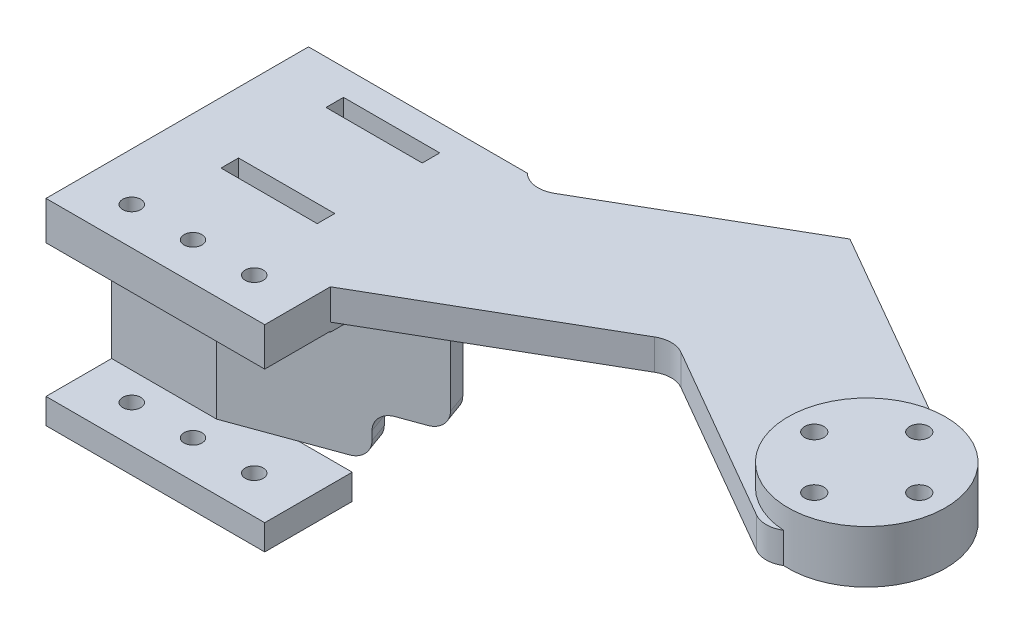
from build123d import *

# Parameters (mm, degrees)
SKETCH_1_W               = 25
SKETCH_1_H               = 10
EXTRUDE_1_DEPTH          = 22.5
SKETCH_2_W               = 25
SKETCH_2_H               = 15.2
CUT_EXTRUDE_1_DEPTH      = 7.5
CUT_EXTRUDE_2_DEPTH      = 36.089172119
CUT_EXTRUDE_2_DEPTH_BACK = 36.089172119
SKETCH_4_R               = 1.03
SKETCH_5_W               = 25
SKETCH_5_H               = 4.5
EXTRUDE_2_DEPTH          = 20
SKETCH_6_W               = 11
SKETCH_6_H               = 2
CUT_EXTRUDE_3_DEPTH      = 4.5
EXTRUDE_3_DEPTH          = 3.5
SKETCH_16_R              = 9
EXTRUDE_4_DEPTH          = 6
FILLET_1_R               = 3
CUT_EXTRUDE_4_REACH      = 94.322
SKETCH_17_R              = 1.1
SKETCH_19_W              = 13
SKETCH_19_H              = 15.1
CUT_EXTRUDE_5_DEPTH      = 10
EXTRUDE_5_REACH          = 95.01
CUT_EXTRUDE_6_REACH      = 96.037
SKETCH_22_W              = 7
SKETCH_22_H              = 5
FILLET_3_R               = 2


with BuildPart() as part:
    # 草图1 → 凸台-拉伸1 (new body)
    with BuildSketch(Plane(origin=(0, 0, 0), x_dir=(1, 0, 0), z_dir=(0, 1, 0))):
        with Locations((12.5, -5)):
            Rectangle(SKETCH_1_W, SKETCH_1_H)
    extrude(amount=EXTRUDE_1_DEPTH)

    # 草图2 → 切除-拉伸1 (cut)
    with BuildSketch(Plane.XY.offset(10)):
        with Locations((12.5, 10.5)):
            Rectangle(SKETCH_2_W, SKETCH_2_H)
    extrude(amount=-CUT_EXTRUDE_1_DEPTH, mode=Mode.SUBTRACT)

    # 草图4 → 切除-拉伸2 (cut, two sides: drawn at the far end of the back side and taken through both)
    with BuildSketch(Plane(origin=(0, 22.5, 0), x_dir=(1, 0, 0), z_dir=(0, 1, 0)).offset(-CUT_EXTRUDE_2_DEPTH_BACK)):
        with Locations(Location((12.5, -5.7, 0), (0, 0, 270))):
            Circle(SKETCH_4_R)
        with Locations(Location((19.5, -5.7, 0), (0, 0, 270))):
            Circle(SKETCH_4_R)
        with Locations(Location((5.5, -5.7, 0), (0, 0, 270))):
            Circle(SKETCH_4_R)
    extrude(amount=CUT_EXTRUDE_2_DEPTH + CUT_EXTRUDE_2_DEPTH_BACK, mode=Mode.SUBTRACT)

    # 草图5 → 凸台-拉伸2 (add)
    with BuildSketch(Plane(origin=(0, 0, 0), x_dir=(-1, 0, 0), z_dir=(0, 0, -1))):
        with Locations((-12.5, 20.25)):
            Rectangle(SKETCH_5_W, SKETCH_5_H)
    extrude(amount=EXTRUDE_2_DEPTH)

    # 草图6 → 切除-拉伸3 (cut)
    with BuildSketch(Plane(origin=(0, 22.5, 0), x_dir=(1, 0, 0), z_dir=(0, 1, 0))):
        with Locations((12.5, 16)):
            Rectangle(SKETCH_6_W, SKETCH_6_H)
        with Locations((12.5, 4)):
            Rectangle(SKETCH_6_W, SKETCH_6_H)
    extrude(amount=-CUT_EXTRUDE_3_DEPTH, mode=Mode.SUBTRACT)

    # 草图15 → 凸台-拉伸3 (add)
    with BuildSketch(Plane(origin=(0, 22.5, 0), x_dir=(1, 0, 0), z_dir=(0, 1, 0))):
        Polygon((25, -2.5), (50, 11.93375673), (75, -2.5), (75, 17.5), (49.967235844, 31.914840335), (25, 17.5), align=None)
    extrude(amount=-EXTRUDE_3_DEPTH)

    # 草图16 → 凸台-拉伸4 (add)
    with BuildSketch(Plane.XZ.offset(-19)):
        with Locations(Location((75.52146997, -8.282050808, 0), (0, 0, 270))):
            Circle(SKETCH_16_R)
    extrude(amount=-EXTRUDE_4_DEPTH)

    # 圆角1
    # the kernel refuses this fillet: 3 mm, written as the material it adds along each edge
    with BuildSketch(Plane(origin=(50, 22.5, -11.93375673), x_dir=(-0.8660254037844394, 0, 0.4999999999999987), z_dir=(0, -1, 0))) as fillet_1_piece_1:
        with BuildLine():
            CenterArc((FILLET_1_R * 0.57735026919, -FILLET_1_R), FILLET_1_R, 90, 60)
            Line((-FILLET_1_R * 0.288675134595, -FILLET_1_R * 0.5), (-FILLET_1_R * 0.305995642671, -FILLET_1_R * 0.49))
            Line((-FILLET_1_R * 0.305995642671, -FILLET_1_R * 0.49), (-FILLET_1_R * 0.0115470053838, FILLET_1_R * 0.02))
            Line((-FILLET_1_R * 0.0115470053838, FILLET_1_R * 0.02), (FILLET_1_R * 0.57735026919, FILLET_1_R * 0.02))
            Line((FILLET_1_R * 0.57735026919, FILLET_1_R * 0.02), (FILLET_1_R * 0.57735026919, 0))
        make_face()
    extrude(amount=3.5)
    with BuildSketch(Plane(origin=(25, 22.5, -17.5), x_dir=(0, 0, -1), z_dir=(0, -1, 0))) as fillet_1_piece_2:
        with BuildLine():
            CenterArc((4.663812226, 2.077959733), FILLET_1_R, 150, 73.840504848)
            Line((2.065736015, 3.577959733), (2.013774491, 3.607959733))
            Line((2.013774491, 3.607959733), (-0.051961524, 0.03))
            Line((-0.051961524, 0.03), (0, -0.06))
            ThreePointArc((0, -0.06), (1.25, -0.06), (2.456723755, -0.041559195))
            Line((2.456723755, -0.041559195), (2.5, 0))
        make_face()
    extrude(amount=3.5)
    # the kernel refuses this fillet: 3 mm, written as the material it takes off along each edge
    with BuildSketch(Plane(origin=(75, 31.321038653, 2.5), x_dir=(0, 0, -1), z_dir=(0, -1, 0))) as fillet_1_2_piece_1:
        with BuildLine():
            CenterArc((4.362283942, -1.555697425), FILLET_1_R, 148.763902171, 61.236097829)
            Line((1.764207731, -3.055697425), (1.712246206, -3.085697425))
            Line((1.712246206, -3.085697425), (-0.051961524, -0.03))
            Line((-0.051961524, -0.03), (0, 0.06))
            ThreePointArc((0, 0.06), (0.898585391, 0.06), (1.745868519, 0.031113948))
            Line((1.745868519, 0.031113948), (1.797170782, 0))
        make_face()
    extrude(amount=21.142077307, mode=Mode.SUBTRACT)

    # 草图17 → 切除-拉伸4 (cut, up to next)
    with BuildSketch(Plane.XZ.offset(-19), mode=Mode.PRIVATE) as cut_extrude_4_sk1:
        with Locations(Location((75.521469969, -14.282050811, 0), (0, 0, 270))):
            Circle(SKETCH_17_R)
    cut_extrude_4_tool1 = extrude(cut_extrude_4_sk1.sketch, amount=-CUT_EXTRUDE_4_REACH, mode=Mode.PRIVATE) & part.part
    # 草图17 → 切除-拉伸4 (cut, up to next)
    with BuildSketch(Plane.XZ.offset(-19), mode=Mode.PRIVATE) as cut_extrude_4_sk2:
        with Locations(Location((75.521469969, -2.282050808, 0), (0, 0, 270))):
            Circle(SKETCH_17_R)
    cut_extrude_4_tool2 = extrude(cut_extrude_4_sk2.sketch, amount=-CUT_EXTRUDE_4_REACH, mode=Mode.PRIVATE) & part.part
    # 草图17 → 切除-拉伸4 (cut, up to next)
    with BuildSketch(Plane.XZ.offset(-19), mode=Mode.PRIVATE) as cut_extrude_4_sk3:
        with Locations(Location((69.521469967, -8.282050809, 0), (0, 0, 270))):
            Circle(SKETCH_17_R)
    cut_extrude_4_tool3 = extrude(cut_extrude_4_sk3.sketch, amount=-CUT_EXTRUDE_4_REACH, mode=Mode.PRIVATE) & part.part
    # 草图17 → 切除-拉伸4 (cut, up to next)
    with BuildSketch(Plane.XZ.offset(-19), mode=Mode.PRIVATE) as cut_extrude_4_sk4:
        with Locations(Location((81.52146997, -8.282050809, 0), (0, 0, 270))):
            Circle(SKETCH_17_R)
    cut_extrude_4_tool4 = extrude(cut_extrude_4_sk4.sketch, amount=-CUT_EXTRUDE_4_REACH, mode=Mode.PRIVATE) & part.part
    add(cut_extrude_4_tool1.solids().sort_by_distance((75.52147, 19, -14.282051))[0], mode=Mode.SUBTRACT)
    add(cut_extrude_4_tool2.solids().sort_by_distance((75.52147, 19, -2.282051))[0], mode=Mode.SUBTRACT)
    add(cut_extrude_4_tool3.solids().sort_by_distance((69.52147, 19, -8.282051))[0], mode=Mode.SUBTRACT)
    add(cut_extrude_4_tool4.solids().sort_by_distance((81.52147, 19, -8.282051))[0], mode=Mode.SUBTRACT)

    # 草图19 → 切除-拉伸5 (cut)
    with BuildSketch(Plane(origin=(0, 0, 0), x_dir=(-1, 0, 0), z_dir=(0, 0, -1))):
        with Locations((-18.5, 10.45)):
            Rectangle(SKETCH_19_W, SKETCH_19_H)
    extrude(amount=-CUT_EXTRUDE_5_DEPTH, mode=Mode.SUBTRACT)

    # 凸台-拉伸5: up to this face of the body (flat: up to its plane)
    extrude_5_end = Plane(part.part.faces().sort_by_distance((53.082748758, 19, -14.052317246))[0])
    # 草图21 → 凸台-拉伸5 (add, up to the picked face)
    with BuildSketch(Plane(origin=(0, 2.9, 0), x_dir=(1, 0, 0), z_dir=(0, 1, 0)), mode=Mode.PRIVATE) as extrude_5_sk1:
        Polygon((12, -2.5), (12, 0), (30.793852416, 6.840402867), (31.597336928, 4.632847313), align=None)
    extrude_5_tool1 = split(extrude(extrude_5_sk1.sketch, amount=EXTRUDE_5_REACH, mode=Mode.PRIVATE), bisect_by=extrude_5_end, keep=Keep.BOTH, mode=Mode.PRIVATE)
    add(extrude_5_tool1.solids().sort_by(Axis((21.599199, 2.9, -2.235102), (0, 1, 0)))[0])

    # 草图22 → 切除-拉伸6 (cut, up to next)
    with BuildSketch(Plane(origin=(2.207217853, 0, 6.064281212), x_dir=(0.9396926207859104, 0, -0.3420201433256632), z_dir=(0.3420201433256632, 0, 0.9396926207859104)), mode=Mode.PRIVATE) as cut_extrude_6_sk1:
        with Locations((27.776311449, 5.4)):
            Rectangle(SKETCH_22_W, SKETCH_22_H)
    cut_extrude_6_tool1 = extrude(cut_extrude_6_sk1.sketch, amount=-CUT_EXTRUDE_6_REACH, mode=Mode.PRIVATE) & part.part
    add(cut_extrude_6_tool1.solids().sort_by_distance((28.308413, 5.4, -3.435777))[0], mode=Mode.SUBTRACT)

    # 圆角3
    fillet_3_edges = [part.edges().sort_by_distance(p)[0] for p in [
        (31.195594672, 7.9, -5.73662509),
        (24.617746326, 2.9, -3.342484086),
        (24.617746326, 7.9, -3.342484086),
    ]]
    fillet(fillet_3_edges, radius=FILLET_3_R)


solid = part.part
